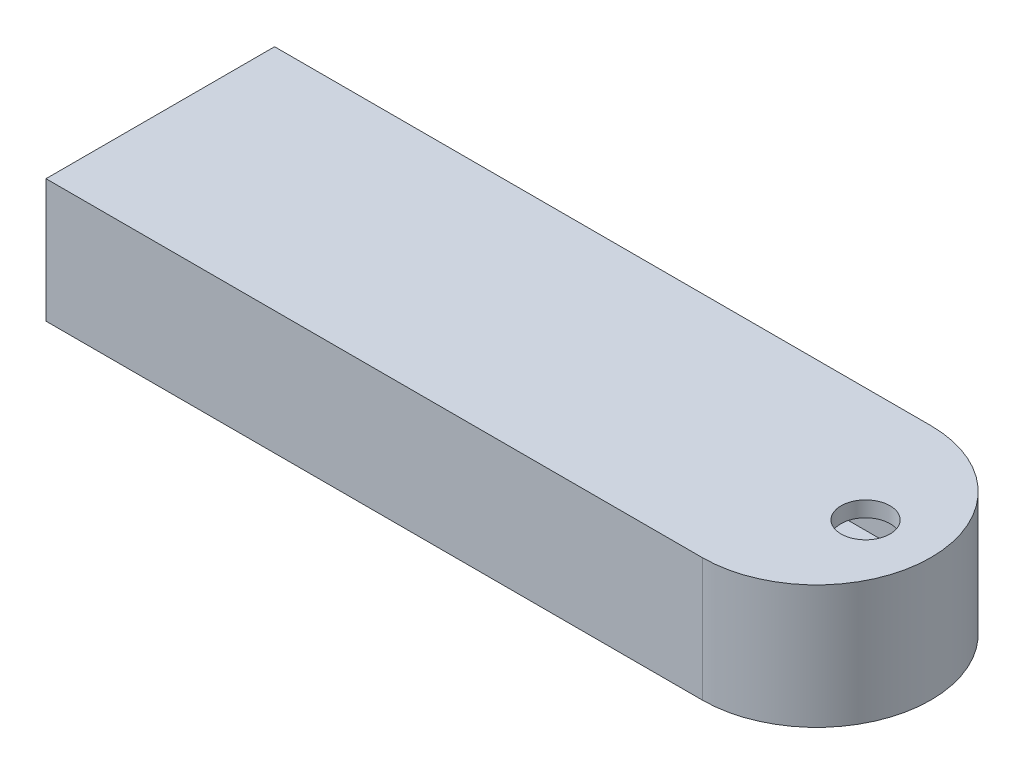
from build123d import *

# Parameters (mm, degrees)
SKETCH1_R                = 3.155
BOSS_EXTRUDE7_DEPTH      = 15.9
SHELL1_T                 = -2
CUT_EXTRUDE5_START       = 2
CUT_EXTRUDE5_OUTLINE_R   = 5.155
CUT_EXTRUDE5_OUTLINE_R_2 = 3.155
CUT_EXTRUDE5_DEPTH       = 11.9


# Read off the part's stored shape, not the designer's step: Cut-Extrude5
with BuildPart() as part:
    # Sketch1 → Boss-Extrude7 (new body)
    with BuildSketch(Plane(origin=(0, 0, 0), x_dir=(1, 0, 0), z_dir=(0, 1, 0))):
        with BuildLine():
            Line((-57.361665301, -13.110958237), (27.188334699, -13.110958237))
            ThreePointArc((27.188334699, -13.110958237), (41.913334699, 1.614041763), (27.188334699, 16.339041763))
            Line((27.188334699, 16.339041763), (-57.361665301, 16.339041763))
            Line((-57.361665301, 16.339041763), (-57.361665301, -13.110958237))
        make_face()
        with Locations(Location((33.498334699, 1.614041763, 0), (0, 0, 270))):
            Circle(SKETCH1_R, mode=Mode.SUBTRACT)
    extrude(amount=BOSS_EXTRUDE7_DEPTH)

    # Shell1
    shell1_openings = [part.faces().sort_by_distance(p)[0] for p in [
        (-57.361665301, 7.95, -1.614041763),
    ]]
    offset(amount=SHELL1_T, openings=shell1_openings, kind=Kind.INTERSECTION)

    # Cut-Extrude5 outline → Cut-Extrude5 (cut)
    with BuildSketch(Plane(origin=(0, 0, 0), x_dir=(1, 0, 0), z_dir=(0, 1, 0)).offset(CUT_EXTRUDE5_START)):
        with Locations((33.498334699, 1.614041763)):
            Circle(CUT_EXTRUDE5_OUTLINE_R)
        with Locations((33.498334699, 1.614041763)):
            Circle(CUT_EXTRUDE5_OUTLINE_R_2, mode=Mode.SUBTRACT)
    extrude(amount=CUT_EXTRUDE5_DEPTH, mode=Mode.SUBTRACT)


solid = part.part
